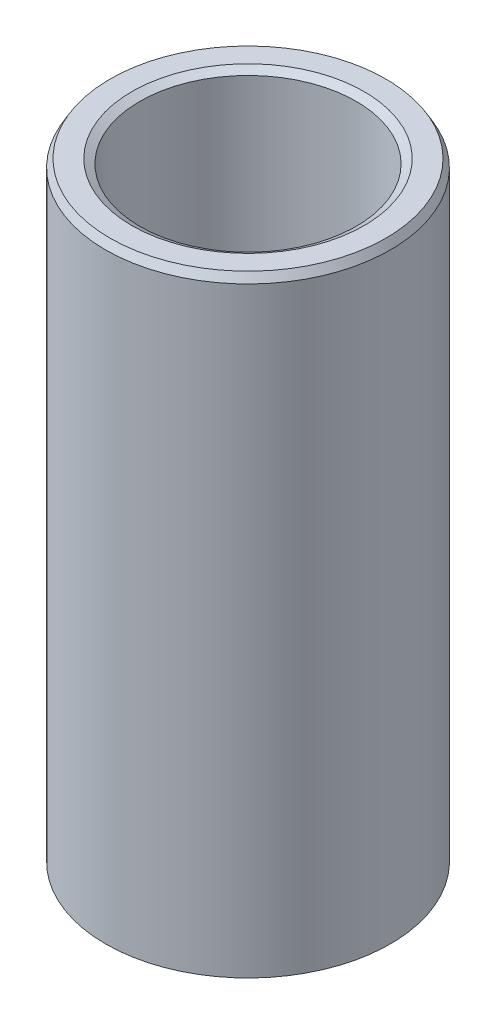
from build123d import *
from OCP.BRepFilletAPI import BRepFilletAPI_MakeChamfer

# Parameters (mm, degrees)
SKETCH1_R           = 42.5
BOSS_EXTRUDE1_DEPTH = 183.027756728
SKETCH2_R           = 32.300133871
CUT_EXTRUDE1_DEPTH  = 193.643867624
CHAMFER1_SIZE       = 2.349064888
CHAMFER1_SIZE2      = 1.356233245


with BuildPart() as part:
    # Sketch1 → Boss-Extrude1 (new body)
    with BuildSketch(Plane(origin=(0, 0, 0), x_dir=(1, 0, 0), z_dir=(0, 1, 0))):
        Circle(SKETCH1_R)
    extrude(amount=BOSS_EXTRUDE1_DEPTH)

    # Sketch2 → Cut-Extrude1 (cut, through all)
    with BuildSketch(Plane(origin=(0, 0, 0), x_dir=(1, 0, 0), z_dir=(0, 1, 0))):
        Circle(SKETCH2_R)
    extrude(amount=CUT_EXTRUDE1_DEPTH, mode=Mode.SUBTRACT)

    # Chamfer1: one chamfer whose edges measure the first distance from different faces: ONE call of the kernel's chamfer builder (chamfer() names one face for all edges)
    chamfer1_edges_1 = [part.edges().sort_by_distance(p)[0] for p in [
        (-32.300133871, 183.027756728, 0),
    ]]
    chamfer1_side_1 = [part.faces().sort_by_distance(p)[0] for p in [
        (-41.297918472, 183.027756728, 0),
    ]]
    chamfer1_edges_2 = [part.edges().sort_by_distance(p)[0] for p in [
        (-32.300133871, 0, 0),
    ]]
    chamfer1_side_2 = [part.faces().sort_by_distance(p)[0] for p in [
        (-32.300133871, 91.513878364, 0),
    ]]
    chamfer1_edges_3 = [part.edges().sort_by_distance(p)[0] for p in [
        (-42.5, 0, 0),
    ]]
    chamfer1_side_3 = [part.faces().sort_by_distance(p)[0] for p in [
        (-41.297918472, 0, 0),
    ]]
    chamfer1_edges_4 = [part.edges().sort_by_distance(p)[0] for p in [
        (-42.5, 183.027756728, 0),
    ]]
    chamfer1_side_4 = [part.faces().sort_by_distance(p)[0] for p in [
        (-42.5, 91.513878364, 0),
    ]]
    chamfer1 = BRepFilletAPI_MakeChamfer(part.part.solid().wrapped)
    for e in chamfer1_edges_1:
        chamfer1.Add(CHAMFER1_SIZE, CHAMFER1_SIZE2, e.wrapped, chamfer1_side_1[0].wrapped)  # the first distance lies on this face
    for e in chamfer1_edges_2:
        chamfer1.Add(CHAMFER1_SIZE, CHAMFER1_SIZE2, e.wrapped, chamfer1_side_2[0].wrapped)  # the first distance lies on this face
    for e in chamfer1_edges_3:
        chamfer1.Add(CHAMFER1_SIZE, CHAMFER1_SIZE2, e.wrapped, chamfer1_side_3[0].wrapped)  # the first distance lies on this face
    for e in chamfer1_edges_4:
        chamfer1.Add(CHAMFER1_SIZE, CHAMFER1_SIZE2, e.wrapped, chamfer1_side_4[0].wrapped)  # the first distance lies on this face
    add(Compound.cast(chamfer1.Shape()), mode=Mode.REPLACE)


solid = part.part
